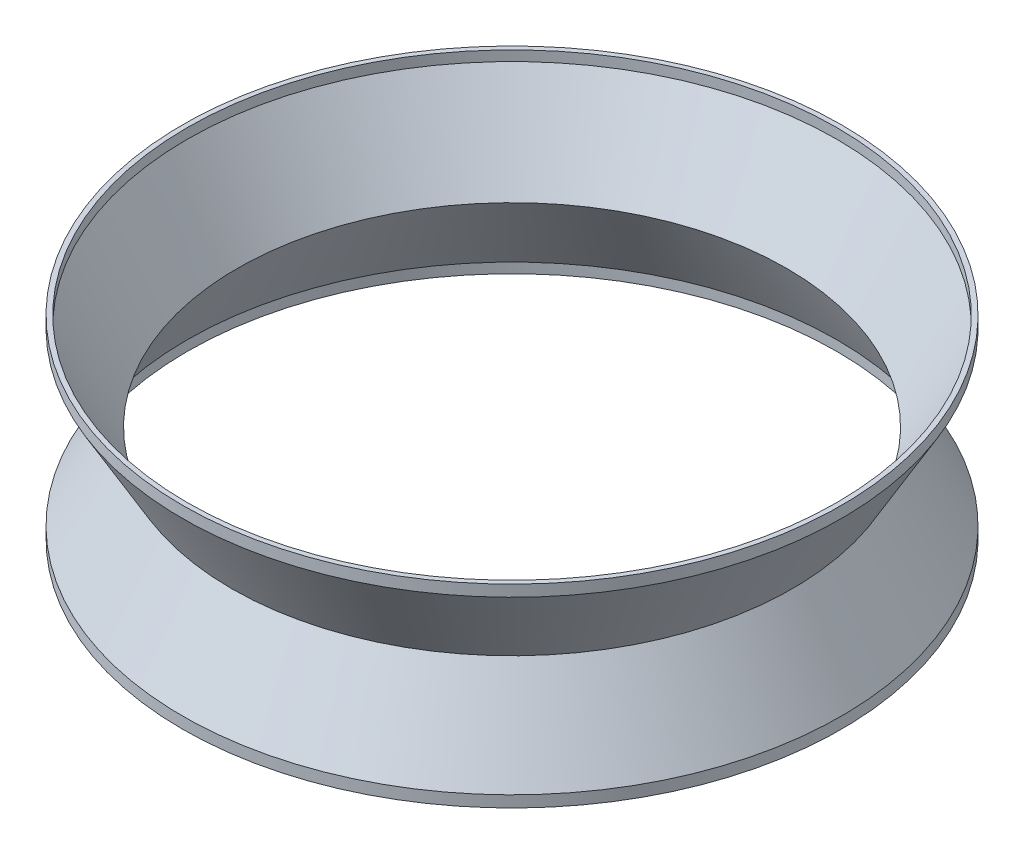
from build123d import *

# Parameters (mm, degrees)
SKETCH_1_R      = 34.670752002
EXTRUDE_1_DEPTH = 1.2
SKETCH_3_R      = 34.670752002
SKETCH_2_R      = 29.48320138


# Read off the part's stored shape, not the designer's step: 쉘1
with BuildPart() as part:
    # 스케치1 → 보스-돌출1 (new body)
    with BuildSketch(Plane(origin=(0, 0, 0), x_dir=(1, 0, 0), z_dir=(0, 1, 0))):
        with Locations(Location((0, 0, 0), (0, 0, 270))):
            Circle(SKETCH_1_R)
    extrude_1 = extrude(amount=EXTRUDE_1_DEPTH)

    # 스케치3 → 로프트1 section 0
    with BuildSketch(Plane(origin=(0, 1.2, 0), x_dir=(1, 0, 0), z_dir=(0, 1, 0))):
        Circle(SKETCH_3_R)
    # 스케치2 → 로프트1 section 1
    with BuildSketch(Plane(origin=(0, 10.2, 0), x_dir=(1, 0, 0), z_dir=(0, 1, 0))):
        Circle(SKETCH_2_R)
    loft_1 = loft()

    # 대칭 복사1: 보스-돌출1, 로프트1 across plane
    add(extrude_1.mirror(Plane.ZX.offset(10.2)))
    add(loft_1.mirror(Plane.ZX.offset(10.2)))

    # 쉘1 outline → 쉘1 (revolve, cut)
    with BuildSketch(Plane.XY):
        Polygon((34.170752002, 0), (34.170752002, 1.066217535), (28.906089901, 10.2), (34.170752002, 19.333782465), (34.170752002, 20.4), (0, 20.4), (0, 0), align=None)
    revolve(axis=Axis((0, 0, 0), (0, 1, 0)), mode=Mode.SUBTRACT)


solid = part.part
